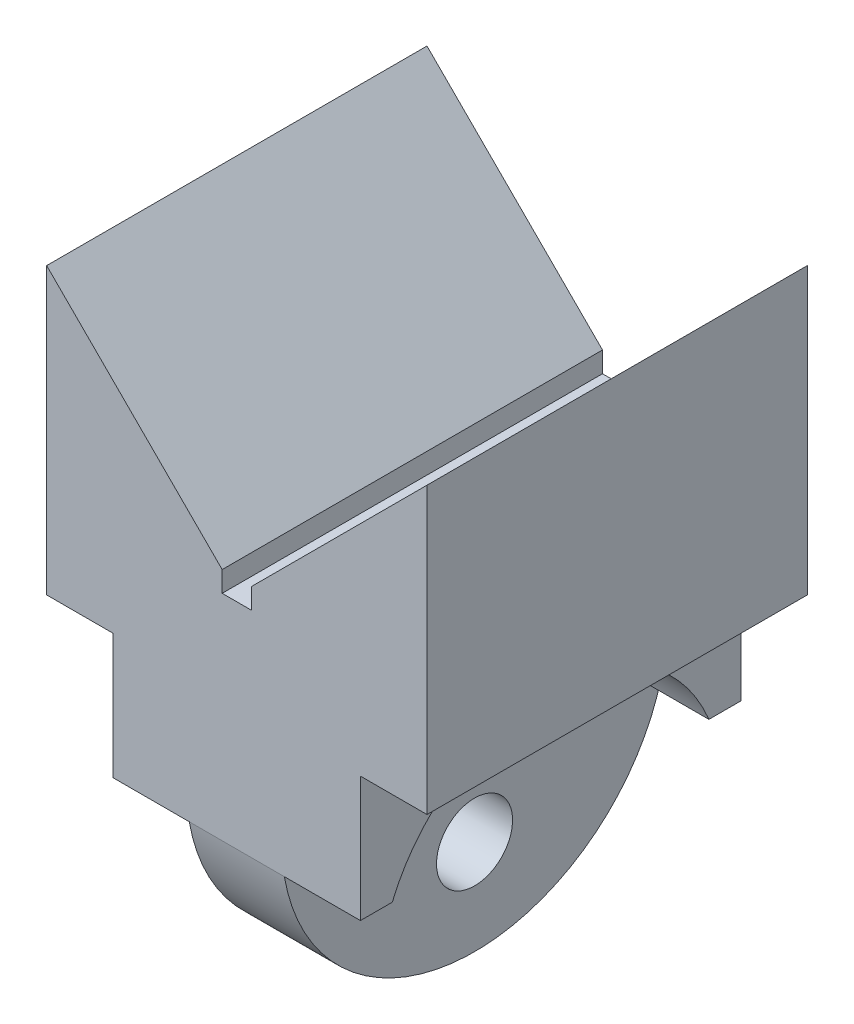
from build123d import *

# Parameters (mm, degrees)
SALIENTE_EXTRUIR1_DEPTH = 20
CROQUIS2_R              = 2
CORTAR_EXTRUIR1_DEPTH   = 39.160843806
SALIENTE_EXTRUIR3_DEPTH = 4
CORTAR_EXTRUIR3_DEPTH   = 39.160843806


with BuildPart() as part:
    # Croquis1 → Saliente-Extruir1 (new body)
    with BuildSketch(Plane.XY):
        Polygon((2.5, 0), (-2.5, 0), (-2.5, 15), (-10, 15), (-10, 30), (-0.771012727, 20.771012727), (-0.771012727, 19.688176129), (0.771012727, 19.688176129), (0.771012727, 20.771012727), (10, 30), (10, 15), (2.5, 15), align=None)
    extrude(amount=SALIENTE_EXTRUIR1_DEPTH)

    # Croquis2 → Cortar-Extruir1 (cut, through all)
    with BuildSketch(Plane.ZY.offset(2.5)):
        with Locations((10, 5)):
            Circle(CROQUIS2_R)
    extrude(amount=-CORTAR_EXTRUIR1_DEPTH, mode=Mode.SUBTRACT)

    # Croquis3 → Saliente-Extruir3 (add)
    with BuildSketch(Plane.ZY.offset(2.5)):
        with BuildLine():
            Line((0, 8.420482436), (0, 15))
            Line((0, 15), (20, 15))
            Line((20, 15), (20, 8.420482436))
            Line((20, 8.420482436), (18.324680168, 8.420482436))
            ThreePointArc((18.324680168, 8.420482436), (10, 14), (1.675319832, 8.420482436))
            Line((1.675319832, 8.420482436), (0, 8.420482436))
        make_face()
    saliente_extruir3 = extrude(amount=SALIENTE_EXTRUIR3_DEPTH)

    # Simetría2: Saliente-Extruir3 across plane
    add(saliente_extruir3.mirror(Plane.ZY))

    # Croquis5 → Cortar-Extruir3 (cut, through all)
    with BuildSketch(Plane.ZY.offset(2.5)):
        with BuildLine():
            ThreePointArc((9.999999976, 0), (3.46347713, 2.385496773), (0, 8.420482436))
            Line((0, 8.420482436), (0, 0))
            Line((0, 0), (9.999999976, 0))
        make_face()
        with BuildLine():
            ThreePointArc((20, 8.420482436), (16.536522852, 2.385496758), (9.999999976, 0))
            Line((9.999999976, 0), (20, 0))
            Line((20, 0), (20, 8.420482436))
        make_face()
    extrude(amount=-CORTAR_EXTRUIR3_DEPTH, mode=Mode.SUBTRACT)


solid = part.part
